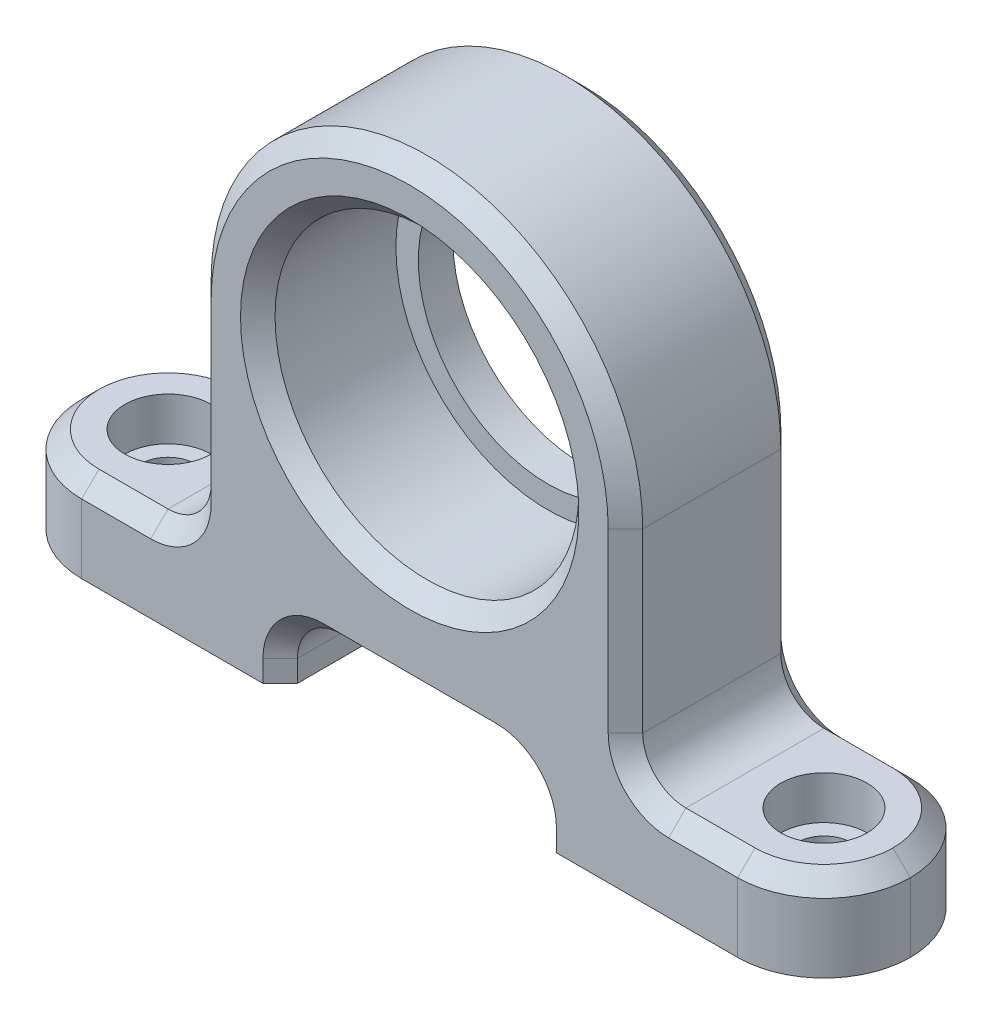
from build123d import *

# Parameters (mm, degrees)
SKETCH_1_W          = 96
SKETCH_1_H          = 20
EXTRUDE_1_DEPTH     = 10
SKETCH_2_R          = 5
CUT_EXTRUDE_1_DEPTH = 5
FILLET_1_R          = 10
SKETCH_3_R          = 3.1
CUT_EXTRUDE_2_DEPTH = 5
CHAMFER_1_SIZE      = 1
SKETCH_4_W          = 50
SKETCH_4_H          = 20
EXTRUDE_2_DEPTH     = 50.5
CUT_EXTRUDE_START   = -20
CUT_EXTRUDE_4_DEPTH = 20
SKETCH_7_R          = 17.6
CUT_EXTRUDE_5_DEPTH = 16
SKETCH_8_R          = 15
CUT_EXTRUDE_6_DEPTH = 16
CHAMFER_3_SIZE      = 2
FILLET_3_R          = 5
CHAMFER_5_SIZE      = 2
SKETCH_9_W          = 30
SKETCH_9_H          = 15
CUT_EXTRUDE_7_DEPTH = 80.776249598
FILLET_4_R          = 5
CHAMFER_6_SIZE      = 2


# Read off the part's stored shape, not the designer's step: 切除-拉伸4
with BuildPart() as part:
    # 草图1 → 凸台-拉伸1 (new body)
    with BuildSketch(Plane(origin=(0, 0, 0), x_dir=(1, 0, 0), z_dir=(0, 1, 0))):
        Rectangle(SKETCH_1_W, SKETCH_1_H)
    extrude(amount=EXTRUDE_1_DEPTH)

    # 草图2 → 切除-拉伸1 (cut)
    with BuildSketch(Plane(origin=(0, 10, 0), x_dir=(1, 0, 0), z_dir=(0, 1, 0))):
        with Locations(Location((-38, 0, 0), (0, 0, 270))):
            Circle(SKETCH_2_R)
        with Locations(Location((38, 0, 0), (0, 0, 90))):
            Circle(SKETCH_2_R)
    extrude(amount=-CUT_EXTRUDE_1_DEPTH, mode=Mode.SUBTRACT)

    # 圆角1
    fillet_1_edges = [part.edges().sort_by_distance(p)[0] for p in [
        (48, 5, -10),
        (48, 5, 10),
        (-48, 5, 10),
        (-48, 5, -10),
    ]]
    fillet(fillet_1_edges, radius=FILLET_1_R - 0.0001)  # a hair under: the kernel refuses the full size

    # 草图3 → 切除-拉伸2 (cut)
    with BuildSketch(Plane(origin=(0, 5, 0), x_dir=(1, 0, 0), z_dir=(0, 1, 0))):
        with Locations(Location((-38, 0, 0), (0, 0, 270))):
            Circle(SKETCH_3_R)
        with Locations(Location((38, 0, 0), (0, 0, 270))):
            Circle(SKETCH_3_R)
    extrude(amount=-CUT_EXTRUDE_2_DEPTH, mode=Mode.SUBTRACT)

    # 倒角1
    chamfer_1_edges = [part.edges().sort_by_distance(p)[0] for p in [
        (-38, 0, -3.1),
        (38, 0, -3.1),
    ]]
    chamfer(chamfer_1_edges, length=CHAMFER_1_SIZE)

    # 草图4 → 凸台-拉伸2 (add)
    with BuildSketch(Plane(origin=(0, 10, 0), x_dir=(1, 0, 0), z_dir=(0, 1, 0))):
        Rectangle(SKETCH_4_W, SKETCH_4_H)
    extrude(amount=EXTRUDE_2_DEPTH)

    # 切除-拉伸4 outline → 切除-拉伸4 (cut)
    with BuildSketch(Plane.XY.offset(10).offset(CUT_EXTRUDE_START)):
        with BuildLine():
            Line((-25, 60.5), (-25, 35.5))
            ThreePointArc((-25, 35.5), (-17.677669559, 53.1776695), (-8.4e-08, 60.5))
            Line((-8.4e-08, 60.5), (-25, 60.5))
        make_face()
        with BuildLine():
            Line((25, 60.5), (-8.4e-08, 60.5))
            ThreePointArc((-8.4e-08, 60.5), (17.6776695, 53.177669559), (25, 35.5))
            Line((25, 35.5), (25, 60.5))
        make_face()
    extrude(amount=CUT_EXTRUDE_4_DEPTH, mode=Mode.SUBTRACT)

    # 草图7 → 切除-拉伸5 (cut)
    with BuildSketch(Plane.XY.offset(10)):
        with Locations((0, 35.5)):
            Circle(SKETCH_7_R)
    extrude(amount=-CUT_EXTRUDE_5_DEPTH, mode=Mode.SUBTRACT)

    # 草图8 → 切除-拉伸6 (cut)
    with BuildSketch(Plane.XY.offset(-6)):
        with Locations((0, 35.5)):
            Circle(SKETCH_8_R)
    extrude(amount=-CUT_EXTRUDE_6_DEPTH, mode=Mode.SUBTRACT)

    # 倒角3
    chamfer_3_edges = [part.edges().sort_by_distance(p)[0] for p in [
        (-17.6, 35.5, 10),
    ]]
    chamfer(chamfer_3_edges, length=CHAMFER_3_SIZE)

    # 圆角3
    fillet_3_edges = [part.edges().sort_by_distance(p)[0] for p in [
        (25, 10, 0),
        (-25, 10, 0),
    ]]
    fillet(fillet_3_edges, radius=FILLET_3_R)

    # 倒角5
    chamfer_5_edges = [part.edges().sort_by_distance(p)[0] for p in [
        (34.00005, 10, 10),
        (34.00005, 10, -10),
        (26.464466094, 11.464466094, -10),
        (26.464466094, 11.464466094, 10),
        (-26.464466094, 11.464466094, 10),
        (-26.464466094, 11.464466094, -10),
        (-34.00005, 10, -10),
        (-34.00005, 10, 10),
        (-45.071097101, 10, -7.071097101),
        (-45.071097101, 10, 7.071097101),
        (45.071097101, 10, 7.071097101),
        (45.071097101, 10, -7.071097101),
        (-25, 25.25, 10),
        (-25, 25.25, -10),
        (25, 25.25, -10),
        (25, 25.25, 10),
        (17.6776695, 53.177669559, -10),
        (17.6776695, 53.177669559, 10),
    ]]
    chamfer(chamfer_5_edges, length=CHAMFER_5_SIZE)

    # 草图9 → 切除-拉伸7 (cut, through all)
    with BuildSketch(Plane.XY.offset(10)):
        Rectangle(SKETCH_9_W, SKETCH_9_H)
    extrude(amount=-CUT_EXTRUDE_7_DEPTH, mode=Mode.SUBTRACT)

    # 圆角4
    fillet_4_edges = [part.edges().sort_by_distance(p)[0] for p in [
        (15, 7.5, 0),
        (-15, 7.5, 0),
    ]]
    fillet(fillet_4_edges, radius=FILLET_4_R)

    # 倒角6
    chamfer_6_edges = [part.edges().sort_by_distance(p)[0] for p in [
        (15, 1.25, -10),
        (15, 1.25, 10),
        (0, 7.5, 10),
        (0, 7.5, -10),
        (-15, 1.25, -10),
        (-15, 1.25, 10),
        (13.535533906, 6.035533906, 10),
        (13.535533906, 6.035533906, -10),
        (-13.535533906, 6.035533906, 10),
        (-13.535533906, 6.035533906, -10),
    ]]
    chamfer(chamfer_6_edges, length=CHAMFER_6_SIZE)


solid = part.part
